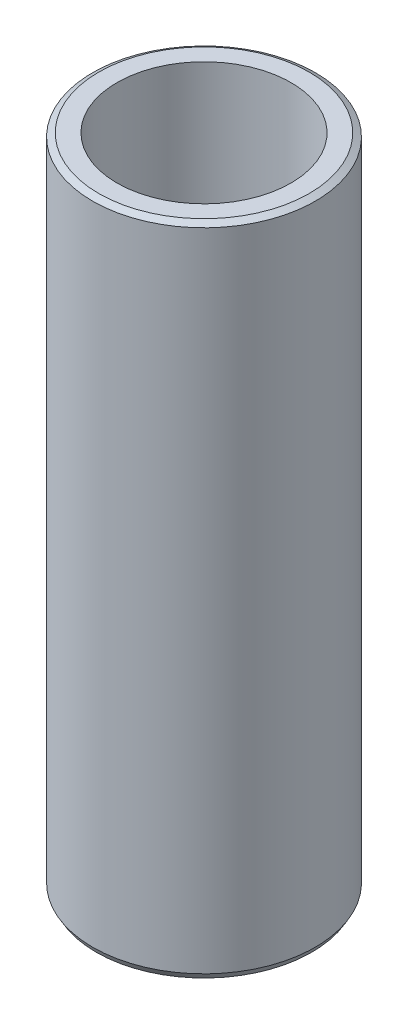
from build123d import *
from OCP.BRepFilletAPI import BRepFilletAPI_MakeChamfer

# Parameters (mm, degrees)
SKETCH1_R           = 45
BOSS_EXTRUDE1_DEPTH = 265.001873523
SKETCH2_R           = 35.172408766
CUT_EXTRUDE1_DEPTH  = 273.536223227
CHAMFER1_SIZE       = 1.433326726
CHAMFER1_SIZE2      = 2.482594713


with BuildPart() as part:
    # Sketch1 → Boss-Extrude1 (new body)
    with BuildSketch(Plane(origin=(0, 0, 0), x_dir=(1, 0, 0), z_dir=(0, 1, 0))):
        Circle(SKETCH1_R)
    extrude(amount=BOSS_EXTRUDE1_DEPTH)

    # Sketch2 → Cut-Extrude1 (cut, through all)
    with BuildSketch(Plane(origin=(0, 0, 0), x_dir=(1, 0, 0), z_dir=(0, 1, 0))):
        Circle(SKETCH2_R)
    extrude(amount=CUT_EXTRUDE1_DEPTH, mode=Mode.SUBTRACT)

    # Chamfer1: one chamfer whose edges measure the first distance from different faces: ONE call of the kernel's chamfer builder (chamfer() names one face for all edges)
    chamfer1_edges_1 = [part.edges().sort_by_distance(p)[0] for p in [
        (-45, 265.001873523, 0),
    ]]
    chamfer1_side_1 = [part.faces().sort_by_distance(p)[0] for p in [
        (-45, 132.500936762, 0),
    ]]
    chamfer1_edges_2 = [part.edges().sort_by_distance(p)[0] for p in [
        (-45, 0, 0),
    ]]
    chamfer1_side_2 = [part.faces().sort_by_distance(p)[0] for p in [
        (-43.727207794, 0, 0),
    ]]
    chamfer1 = BRepFilletAPI_MakeChamfer(part.part.solid().wrapped)
    for e in chamfer1_edges_1:
        chamfer1.Add(CHAMFER1_SIZE, CHAMFER1_SIZE2, e.wrapped, chamfer1_side_1[0].wrapped)  # the first distance lies on this face
    for e in chamfer1_edges_2:
        chamfer1.Add(CHAMFER1_SIZE, CHAMFER1_SIZE2, e.wrapped, chamfer1_side_2[0].wrapped)  # the first distance lies on this face
    add(Compound.cast(chamfer1.Shape()), mode=Mode.REPLACE)


solid = part.part
